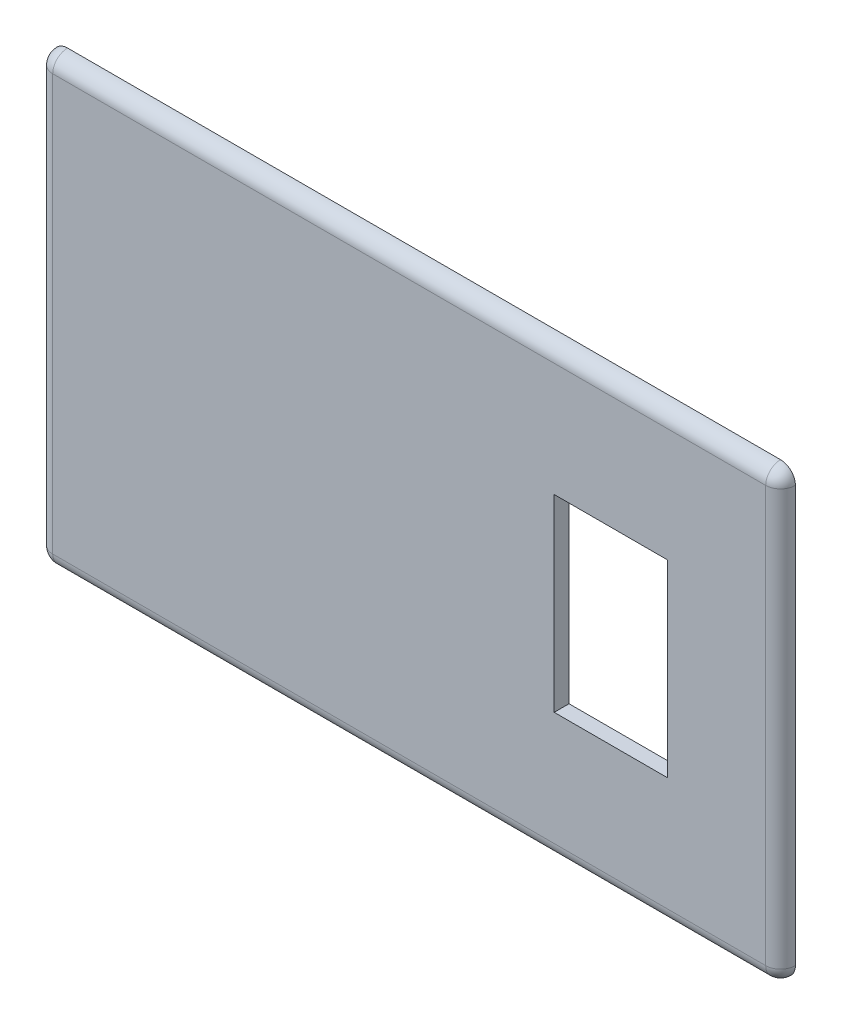
from build123d import *

# Parameters (mm, degrees)
SKETCH1_W           = 100
SKETCH1_H           = 60
BOSS_EXTRUDE1_DEPTH = 2
FILLET1_R           = 2
SKETCH2_W           = 15.24
SKETCH2_H           = 25.4
CUT_EXTRUDE1_DEPTH  = 59.343808583


with BuildPart() as part:
    # Sketch1 → Boss-Extrude1 (new body)
    with BuildSketch(Plane.XY):
        Rectangle(SKETCH1_W, SKETCH1_H)
    extrude(amount=BOSS_EXTRUDE1_DEPTH)

    # Fillet1
    fillet1_edges = [part.edges().sort_by_distance(p)[0] for p in [
        (0, 30, 2),
        (-50, 0, 2),
        (0, -30, 2),
        (50, 0, 2),
        (-50, -30, 1),
        (-50, 30, 1),
        (50, 30, 1),
        (50, -30, 1),
    ]]
    fillet(fillet1_edges, radius=FILLET1_R - 0.0001)  # a hair under: the kernel refuses the full size

    # Sketch2 → Cut-Extrude1 (cut, through all)
    with BuildSketch(Plane.XY.offset(2)):
        with Locations((27.14, 0)):
            Rectangle(SKETCH2_W, SKETCH2_H)
    extrude(amount=-CUT_EXTRUDE1_DEPTH, mode=Mode.SUBTRACT)


solid = part.part
